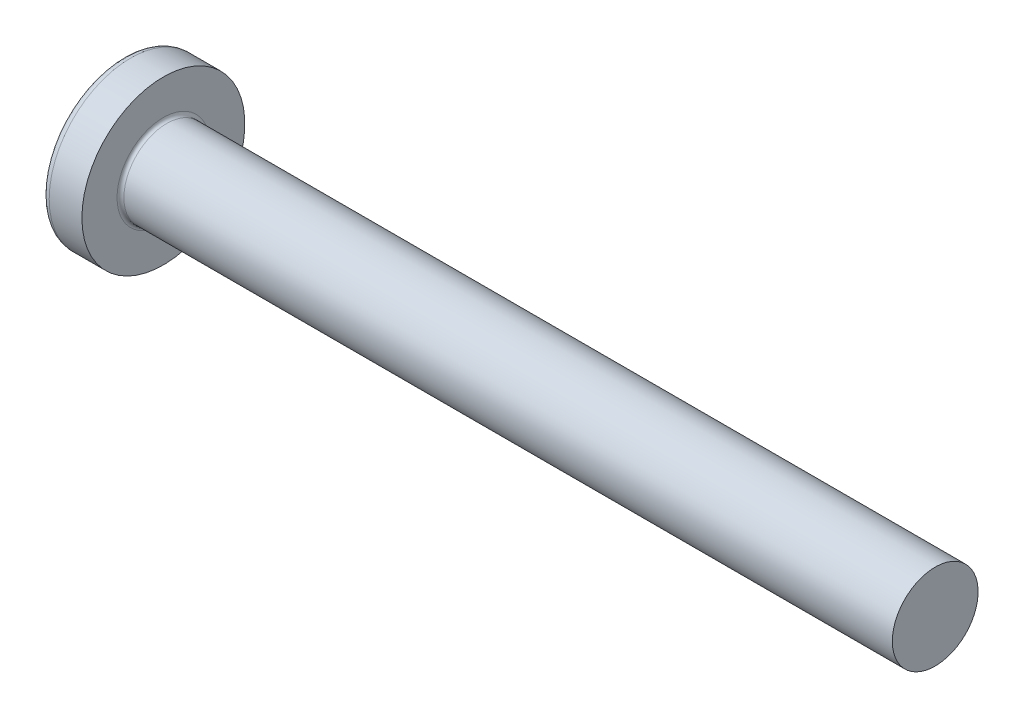
from build123d import *

# Parameters (mm, degrees)
RECPAT_COUNT = 2
RECPAT_ANGLE = 90


with BuildPart() as part:
    # Fillet1: read off the stored shape, not the designer's step
    # Fillet1 outline → Fillet1 (revolve)
    with BuildSketch(Plane.YX):
        with BuildLine():
            Line((2.5, 3.9), (2.5, 48.7))
            Line((2.5, 48.7), (0, 48.7))
            Line((0, 48.7), (0, 0))
            ThreePointArc((0, 0), (2.386856711, 0.364365446), (4.556291394, 1.42427124))
            ThreePointArc((4.556291394, 1.42427124), (4.698642149, 1.58538712), (4.75, 1.79415598))
            Line((4.75, 1.79415598), (4.75, 3.7))
            Line((4.75, 3.7), (2.7, 3.7))
            ThreePointArc((2.7, 3.7), (2.558578644, 3.758578644), (2.5, 3.9))
        make_face()
    revolve(axis=Axis((0, 0, 0), (1, 0, 0)))

    # Sketch3 → Recess section 0
    with BuildSketch(Plane(origin=(0, 0, 0), x_dir=(0, 0, -1), z_dir=(1, 0, 0))):
        with BuildLine():
            Line((0.515, -2.35), (-0.515, -2.35))
            Line((-0.515, -2.35), (-0.515, 2.35))
            Line((-0.515, 2.35), (0.515, 2.35))
            Line((0.515, 2.35), (0.515, -2.35))
        make_face()
    # Sketch4 → Recess section 1
    with BuildSketch(Plane(origin=(2.74, 0, 0), x_dir=(0, 0, -1), z_dir=(1, 0, 0))):
        with BuildLine():
            Line((0.515, -0.983886622), (-0.515, -0.983886622))
            Line((-0.515, -0.983886622), (-0.515, 0.983886622))
            Line((-0.515, 0.983886622), (0.515, 0.983886622))
            Line((0.515, 0.983886622), (0.515, -0.983886622))
        make_face()
    recess = loft(mode=Mode.SUBTRACT)

    # RecPat: Recess ×2 about axis
    recpat_axis = Axis((0, 0, 0), (1, 0, 0))
    for i in range(1, RECPAT_COUNT):
        add(recess.rotate(recpat_axis, i * RECPAT_ANGLE / (RECPAT_COUNT - 1)), mode=Mode.SUBTRACT)

    # RecCorSke → RecessCore (revolve, cut)
    with BuildSketch(Plane.XY, mode=Mode.PRIVATE) as recesscore_sk:
        Polygon((0, 0), (0, 1.042599465), (2.74, 0.851), (3.016506661, 0), align=None)
    revolve(recesscore_sk.sketch.rotate(Axis((-3.175, 0, 0), (1, 0, 0)), 90), axis=Axis((-3.175, 0, 0), (1, 0, 0)), mode=Mode.SUBTRACT)


solid = part.part
